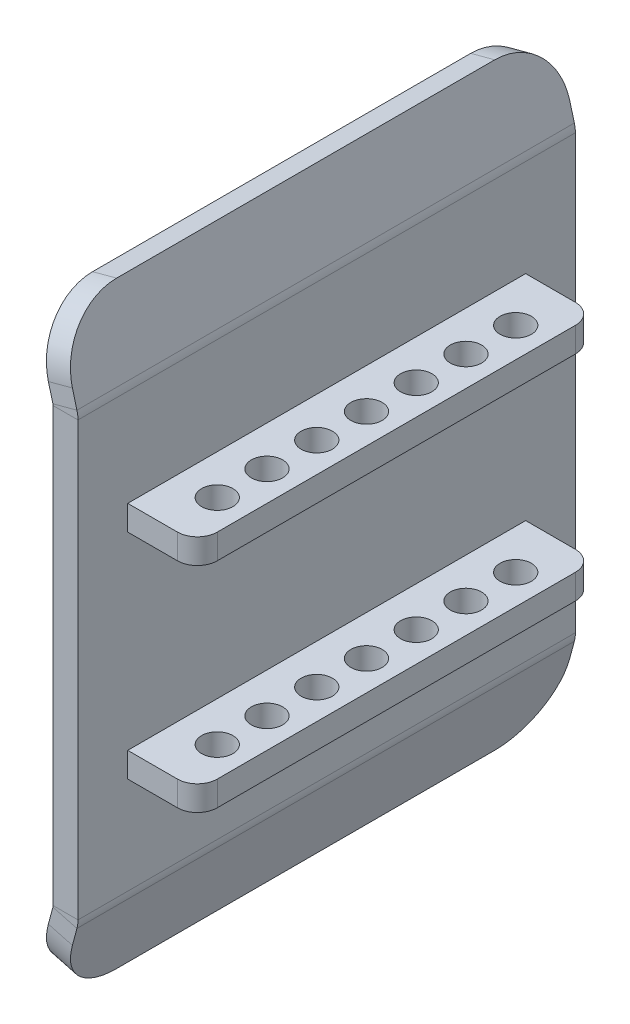
from build123d import *

# Parameters (mm, degrees)
BASE_FLANGE1_DEPTH         = 3.175
SKETCHED_START             = -31.75
SKETCHED_BEND3_DEPTH       = 63.5
SKETCHED_START_2           = -24.135978559
SKETCHED_BEND3_2_DEPTH     = 48.271957118
SKETCHED_BEND3_3_DEPTH     = 63.5
SKETCHED_START_3           = 4.384939983
SKETCHED_BEND3_4_DEPTH     = 2.901009715
SKETCHED_START_4           = 4.370325746
SKETCHED_BEND3_5_DEPTH     = 2.915623952
SKETCHED_START_5           = 3
SKETCHED_BEND3_6_DEPTH     = 4.104292999
SKETCHED_BEND3_7_DEPTH     = 4.285949698
BOSS_EXTRUDE4_DEPTH        = 8.89
BOSS_EXTRUDE4_DEPTH_BACK   = 3.175
SKETCH11_W                 = 50.8
SKETCH11_H                 = 3.175
BOSS_EXTRUDE4_2_DEPTH      = 8.89
BOSS_EXTRUDE4_2_DEPTH_BACK = 3.175
CUT_EXTRUDE1_START         = -30.48
SKETCH14_R                 = 2
CUT_EXTRUDE1_DEPTH         = 30.48
FILLET1_R                  = 2.54
FILLET2_R                  = 2.54
SKETCH15_W                 = 50.8
SKETCH15_H                 = 3.175
CUT_EXTRUDE3_DEPTH         = 2.54


with BuildPart() as part:
    # Base-Flange1: sheet metal written as solids
    # Sketch1 → Base-Flange1 (new body)
    with BuildSketch(Plane(origin=(0, 0, 0), x_dir=(0, 0, -1), z_dir=(1, 0, 0))):
        with BuildLine():
            Line((24.135978559, -38.1), (-24.135978559, -38.1))
            ThreePointArc((-24.135978559, -38.1), (-29.519904752, -35.869904752), (-31.75, -30.485978559))
            Line((-31.75, -30.485978559), (-31.75, 30.485978559))
            ThreePointArc((-31.75, 30.485978559), (-29.519904752, 35.869904752), (-24.135978559, 38.1))
            Line((-24.135978559, 38.1), (24.135978559, 38.1))
            ThreePointArc((24.135978559, 38.1), (29.519904752, 35.869904752), (31.75, 30.485978559))
            Line((31.75, 30.485978559), (31.75, -30.485978559))
            ThreePointArc((31.75, -30.485978559), (29.519904752, -35.869904752), (24.135978559, -38.1))
        make_face()
    extrude(amount=-BASE_FLANGE1_DEPTH)

    # Sketched Bend3: read off the stored shape, not the designer's step
    # Sketched Bend3 outline → Sketched Bend3 (cut)
    with BuildSketch(Plane.XY.offset(SKETCHED_START)):
        Polygon((-2.938378837, -38.1), (-3.175, -38.03659755), (-3.175, -38.1), align=None)
        Polygon((-3.175, 38.1), (-3.175, 38.03659755), (-2.938378837, 38.1), align=None)
        with BuildLine():
            Line((-0.133284538, -28.648172598), (-2.665894057, -38.1))
            Line((-2.665894057, -38.1), (0, -38.1))
            Line((0, -38.1), (0, -27.635776021))
            ThreePointArc((0, -27.635776021), (-0.03346428, -28.146342275), (-0.133284538, -28.648172598))
        make_face()
        with BuildLine():
            Line((0, 38.1), (-2.665894057, 38.1))
            Line((-2.665894057, 38.1), (-0.133284538, 28.648172598))
            ThreePointArc((-0.133284538, 28.648172598), (-0.03346428, 28.146342275), (0, 27.635776021))
            Line((0, 27.635776021), (0, 38.1))
        make_face()
    extrude(amount=SKETCHED_BEND3_DEPTH, mode=Mode.SUBTRACT)

    # Sketched Bend3 2 outline → Sketched Bend3 2 (add)
    with BuildSketch(Plane.XY.offset(SKETCHED_START_2)):
        with BuildLine():
            ThreePointArc((-3.175, -27.635776021), (-3.181301715, -27.731921614), (-3.200099036, -27.82642213))
            Line((-3.200099036, -27.82642213), (-5.750961575, -37.346370727))
            Line((-5.750961575, -37.346370727), (-3.175, -38.03659755))
            Line((-3.175, -38.03659755), (-3.175, -27.635776021))
        make_face()
        with BuildLine():
            ThreePointArc((-3.200099036, 27.82642213), (-3.181301715, 27.731921614), (-3.175, 27.635776021))
            Line((-3.175, 27.635776021), (-3.175, 38.03659755))
            Line((-3.175, 38.03659755), (-5.750961575, 37.346370727))
            Line((-5.750961575, 37.346370727), (-3.200099036, 27.82642213))
        make_face()
        Polygon((-2.665894057, -38.1), (-2.938378837, -38.1), (-2.684147076, -38.168121195), align=None)
        Polygon((-2.684147076, 38.168121195), (-2.938378837, 38.1), (-2.665894057, 38.1), align=None)
    extrude(amount=SKETCHED_BEND3_2_DEPTH)

    # Sketched Bend3 3 outline → Sketched Bend3 3 (add)
    with BuildSketch(Plane.XY.offset(SKETCHED_START)):
        with BuildLine():
            ThreePointArc((-3.200099036, 27.82642213), (-3.181301715, 27.731921614), (-3.175, 27.635776021))
            Line((-3.175, 27.635776021), (-3.175, 38.03659755))
            Line((-3.175, 38.03659755), (-5.750961575, 37.346370727))
            Line((-5.750961575, 37.346370727), (-3.200099036, 27.82642213))
        make_face()
        with BuildLine():
            ThreePointArc((-3.175, -27.635776021), (-3.181301715, -27.731921614), (-3.200099036, -27.82642213))
            Line((-3.200099036, -27.82642213), (-5.750961575, -37.346370727))
            Line((-5.750961575, -37.346370727), (-3.175, -38.03659755))
            Line((-3.175, -38.03659755), (-3.175, -27.635776021))
        make_face()
    extrude(amount=SKETCHED_BEND3_3_DEPTH)

    # Sketched Bend3 4 outline → Sketched Bend3 4 (add)
    with BuildSketch(Plane(origin=(0, 0, 0), x_dir=(0.2588190451025211, 0.9659258262890682, 0), z_dir=(0.9659258262890682, -0.2588190451025211, 0)).offset(SKETCHED_START_3)):
        with BuildLine():
            Line((-28, 31.75), (-29.948260946, 31.75))
            ThreePointArc((-29.948260946, 31.75), (-35.332187139, 29.519904752), (-37.562282387, 24.135978559))
            Line((-37.562282387, 24.135978559), (-28, 24.135978559))
            Line((-28, 24.135978559), (-28, 31.75))
        make_face()
        with BuildLine():
            Line((-28, -24.135978559), (-37.562282387, -24.135978559))
            ThreePointArc((-37.562282387, -24.135978559), (-35.332187139, -29.519904752), (-29.948260946, -31.75))
            Line((-29.948260946, -31.75), (-28, -31.75))
            Line((-28, -31.75), (-28, -24.135978559))
        make_face()
    extrude(amount=SKETCHED_BEND3_4_DEPTH)

    # Sketched Bend3 5 outline → Sketched Bend3 5 (add)
    with BuildSketch(Plane(origin=(0, 0, 0), x_dir=(-0.2588190451025211, 0.9659258262890682, 0), z_dir=(0.9659258262890682, 0.2588190451025211, 0)).offset(SKETCHED_START_4)):
        with BuildLine():
            Line((28, -31.75), (29.948260946, -31.75))
            ThreePointArc((29.948260946, -31.75), (35.332187139, -29.519904752), (37.562282387, -24.135978559))
            Line((37.562282387, -24.135978559), (28, -24.135978559))
            Line((28, -24.135978559), (28, -31.75))
        make_face()
        with BuildLine():
            Line((28, 24.135978559), (37.562282387, 24.135978559))
            ThreePointArc((37.562282387, 24.135978559), (35.332187139, 29.519904752), (29.948260946, 31.75))
            Line((29.948260946, 31.75), (28, 31.75))
            Line((28, 31.75), (28, 24.135978559))
        make_face()
    extrude(amount=SKETCHED_BEND3_5_DEPTH)

    # Sketched Bend3 6 outline → Sketched Bend3 6 (cut)
    with BuildSketch(Plane(origin=(0, 0, 0), x_dir=(0.2588190451025211, 0.9659258262890682, 0), z_dir=(0.9659258262890682, -0.2588190451025211, 0)).offset(SKETCHED_START_5)):
        with BuildLine():
            ThreePointArc((-37.562282387, 24.135978559), (-35.332187139, 29.519904752), (-29.948260946, 31.75))
            Line((-29.948260946, 31.75), (-28, 31.75))
            Line((-28, 31.75), (-28, 33))
            Line((-28, 33), (-37.562282387, 33))
            Line((-37.562282387, 33), (-37.562282387, 24.135978559))
        make_face()
        with BuildLine():
            ThreePointArc((-29.948260946, -31.75), (-35.332187139, -29.519904752), (-37.562282387, -24.135978559))
            Line((-37.562282387, -24.135978559), (-37.562282387, -33))
            Line((-37.562282387, -33), (-28, -33))
            Line((-28, -33), (-28, -31.75))
            Line((-28, -31.75), (-29.948260946, -31.75))
        make_face()
    extrude(amount=SKETCHED_BEND3_6_DEPTH, mode=Mode.SUBTRACT)

    # Sketched Bend3 7 outline → Sketched Bend3 7 (cut)
    with BuildSketch(Plane(origin=(0, 0, 0), x_dir=(-0.2588190451025211, 0.9659258262890682, 0), z_dir=(0.9659258262890682, 0.2588190451025211, 0)).offset(SKETCHED_START_5)):
        with BuildLine():
            ThreePointArc((37.562282387, -24.135978559), (35.332187139, -29.519904752), (29.948260946, -31.75))
            Line((29.948260946, -31.75), (28, -31.75))
            Line((28, -31.75), (28, -33))
            Line((28, -33), (37.562282386, -33))
            Line((37.562282386, -33), (37.562282387, -24.135978559))
        make_face()
        with BuildLine():
            ThreePointArc((29.948260946, 31.75), (35.332187139, 29.519904752), (37.562282387, 24.135978559))
            Line((37.562282387, 24.135978559), (37.562282386, 33))
            Line((37.562282386, 33), (28, 33))
            Line((28, 33), (28, 31.75))
            Line((28, 31.75), (29.948260946, 31.75))
        make_face()
    extrude(amount=SKETCHED_BEND3_7_DEPTH, mode=Mode.SUBTRACT)

    # Sketch15 → Cut-Extrude3 (cut)
    with BuildSketch(Plane.ZY.offset(3.175)):
        with Locations((0, 13.6525)):
            Rectangle(SKETCH15_W, SKETCH15_H)
        with Locations((0, -13.6525)):
            Rectangle(SKETCH15_W, SKETCH15_H)
    extrude(amount=-CUT_EXTRUDE3_DEPTH, mode=Mode.SUBTRACT)


with BuildPart() as body_2:
    # Sketch11 → Boss-Extrude4 (new, two sides: drawn at the far end of the back side and taken through both)
    with BuildSketch(Plane(origin=(0, 0, 0), x_dir=(0, 0, -1), z_dir=(1, 0, 0)).offset(-BOSS_EXTRUDE4_DEPTH_BACK)):
        with Locations((0, -13.6525)):
            Rectangle(SKETCH11_W, SKETCH11_H)
    extrude(amount=BOSS_EXTRUDE4_DEPTH + BOSS_EXTRUDE4_DEPTH_BACK)


with BuildPart() as body_3:
    # Sketch11 → Boss-Extrude4 2 (new, two sides: drawn at the far end of the back side and taken through both)
    with BuildSketch(Plane(origin=(0, 0, 0), x_dir=(0, 0, -1), z_dir=(1, 0, 0)).offset(-BOSS_EXTRUDE4_2_DEPTH_BACK)):
        with Locations((0, 13.6525)):
            Rectangle(SKETCH11_W, SKETCH11_H)
    extrude(amount=BOSS_EXTRUDE4_2_DEPTH + BOSS_EXTRUDE4_2_DEPTH_BACK)


with BuildPart() as cut_extrude1_tool:
    # Sketch14 → Cut-Extrude1 (new body)
    with BuildSketch(Plane(origin=(0, 15.24, 0), x_dir=(1, 0, 0), z_dir=(0, 1, 0)).offset(CUT_EXTRUDE1_START)):
        with Locations(Location((5.08, -12.7, 0), (0, 0, 270))):
            Circle(SKETCH14_R)
        with Locations(Location((5.08, -6.35, 0), (0, 0, 270))):
            Circle(SKETCH14_R)
        with Locations(Location((5.08, 0, 0), (0, 0, 270))):
            Circle(SKETCH14_R)
        with Locations(Location((5.08, 6.35, 0), (0, 0, 270))):
            Circle(SKETCH14_R)
        with Locations(Location((5.08, 12.7, 0), (0, 0, 270))):
            Circle(SKETCH14_R)
        with Locations(Location((5.08, -19.05, 0), (0, 0, 270))):
            Circle(SKETCH14_R)
        with Locations(Location((5.08, 19.05, 0), (0, 0, 270))):
            Circle(SKETCH14_R)
    extrude(amount=CUT_EXTRUDE1_DEPTH)


with BuildPart() as body_2_1:
    add(body_2.part)

    # Cut-Extrude1: cut by cut_extrude1_tool
    add(cut_extrude1_tool.part, mode=Mode.SUBTRACT)

    # Fillet1
    fillet1_edges = [body_2_1.edges().sort_by_distance(p)[0] for p in [
        (8.89, -13.6525, 25.4),
        (8.89, -13.6525, -25.4),
    ]]
    fillet(fillet1_edges, radius=FILLET1_R)


with BuildPart() as body_3_1:
    add(body_3.part)

    # Cut-Extrude1: cut by cut_extrude1_tool
    add(cut_extrude1_tool.part, mode=Mode.SUBTRACT)

    # Fillet2
    fillet2_edges = [body_3_1.edges().sort_by_distance(p)[0] for p in [
        (8.89, 13.6525, 25.4),
        (8.89, 13.6525, -25.4),
    ]]
    fillet(fillet2_edges, radius=FILLET2_R)


solid = Compound([part.part, body_2_1.part, body_3_1.part])
